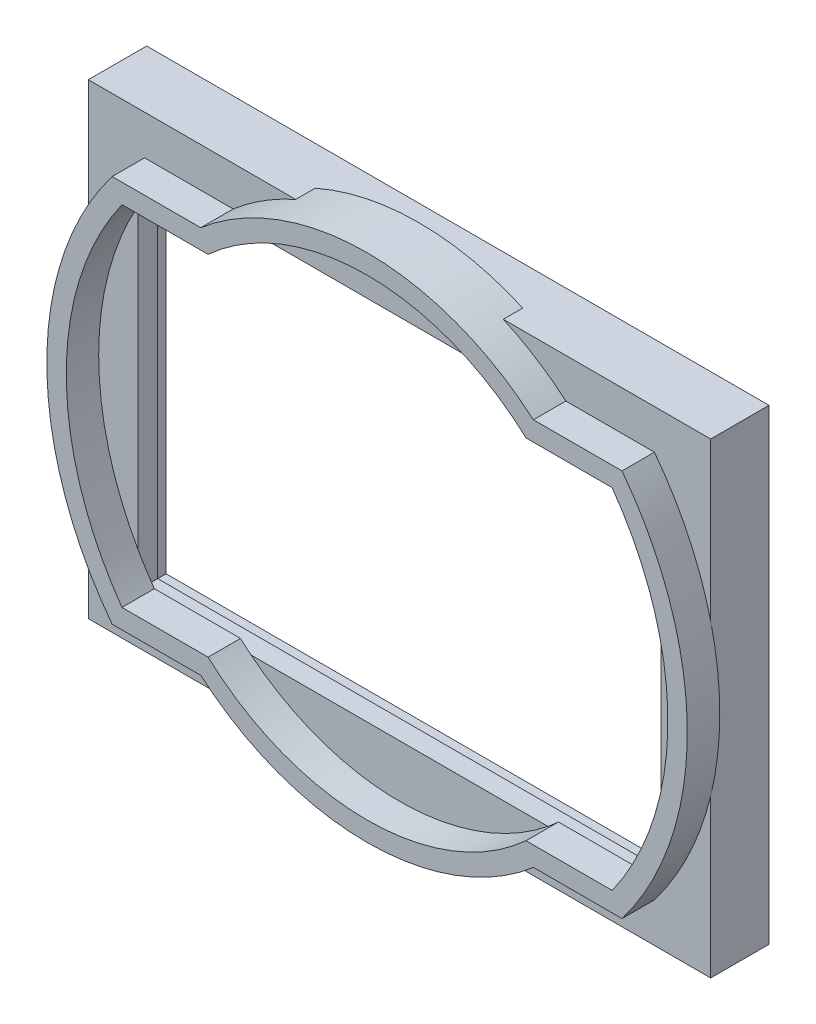
from build123d import *

# Parameters (mm, degrees)
EXTRUDE_1_DEPTH     = 2.5
EXTRUDE_START       = 1.5
SKETCH_3_W          = 40.3
SKETCH_3_H          = 28.3
EXTRUDE_2_DEPTH     = 1.5
SKETCH_4_W          = 48
SKETCH_4_H          = 36
SKETCH_4_W_2        = 45
SKETCH_4_H_2        = 33
EXTRUDE_3_DEPTH     = 3
EXTRUDE_4_DEPTH     = 1.5
CUT_EXTRUDE_1_DEPTH = 1.5


with BuildPart() as part:
    # 草图1 → 凸台-拉伸1 (new body)
    with BuildSketch(Plane.XY):
        with BuildLine():
            Line((-19.661828501, 14.95), (-12.82916599, 14.95))
            ThreePointArc((-12.82916599, 14.95), (0, 19.7), (12.82916599, 14.95))
            Line((12.82916599, 14.95), (19.661828501, 14.95))
            ThreePointArc((19.661828501, 14.95), (24.7, 0), (19.661828501, -14.95))
            Line((19.661828501, -14.95), (12.82916599, -14.95))
            ThreePointArc((12.82916599, -14.95), (0, -19.7), (-12.82916599, -14.95))
            Line((-12.82916599, -14.95), (-19.661828501, -14.95))
            ThreePointArc((-19.661828501, -14.95), (-24.7, 0), (-19.661828501, 14.95))
        make_face()
        with BuildLine():
            Line((-18.903372715, 13.45), (-12.261219352, 13.45))
            ThreePointArc((-12.261219352, 13.45), (0, 18.2), (12.261219352, 13.45))
            Line((12.261219352, 13.45), (18.903372715, 13.45))
            ThreePointArc((18.903372715, 13.45), (23.2, 0), (18.903372715, -13.45))
            Line((18.903372715, -13.45), (12.261219352, -13.45))
            ThreePointArc((12.261219352, -13.45), (0, -18.2), (-12.261219352, -13.45))
            Line((-12.261219352, -13.45), (-18.903372715, -13.45))
            ThreePointArc((-18.903372715, -13.45), (-23.2, 0), (-18.903372715, 13.45))
        make_face(mode=Mode.SUBTRACT)
    extrude(amount=EXTRUDE_1_DEPTH)

    # 草图3 → 凸台-拉伸2 (add)
    with BuildSketch(Plane(origin=(0, 0, 0), x_dir=(-1, 0, 0), z_dir=(0, 0, -1)).offset(EXTRUDE_START)):
        with BuildLine():
            Line((-21.5, -12.158947323), (-21.5, -15.5))
            Line((-21.5, -15.5), (-12.158947323, -15.5))
            ThreePointArc((-12.158947323, -15.5), (0, -19.7), (12.158947323, -15.5))
            Line((12.158947323, -15.5), (21.5, -15.5))
            Line((21.5, -15.5), (21.5, -12.158947323))
            ThreePointArc((21.5, -12.158947323), (24.7, 0), (21.5, 12.158947323))
            Line((21.5, 12.158947323), (21.5, 15.5))
            Line((21.5, 15.5), (12.158947323, 15.5))
            ThreePointArc((12.158947323, 15.5), (0, 19.7), (-12.158947323, 15.5))
            Line((-12.158947323, 15.5), (-21.5, 15.5))
            Line((-21.5, 15.5), (-21.5, 12.158947323))
            ThreePointArc((-21.5, 12.158947323), (-24.7, 0), (-21.5, -12.158947323))
        make_face()
        Rectangle(SKETCH_3_W, SKETCH_3_H, mode=Mode.SUBTRACT)
    extrude(amount=-EXTRUDE_2_DEPTH)

    # 草图4 → 凸台-拉伸3 (add)
    with BuildSketch(Plane(origin=(0, 0, -1.5), x_dir=(-1, 0, 0), z_dir=(0, 0, -1))):
        Rectangle(SKETCH_4_W, SKETCH_4_H)
        Rectangle(SKETCH_4_W_2, SKETCH_4_H_2, mode=Mode.SUBTRACT)
    extrude(amount=EXTRUDE_3_DEPTH)

    # 草图4<2> → 凸台-拉伸4 (add)
    with BuildSketch(Plane(origin=(0, 0, -1.5), x_dir=(-1, 0, 0), z_dir=(0, 0, -1))):
        with BuildLine():
            ThreePointArc((-21.5, -12.158947323), (-22.968434744, -9.085208055), (-24, -5.838664231))
            Line((-24, -5.838664231), (-24, -18))
            Line((-24, -18), (-8.005623024, -18))
            ThreePointArc((-8.005623024, -18), (-10.159477069, -16.87824119), (-12.158947323, -15.5))
            Line((-12.158947323, -15.5), (-21.5, -15.5))
            Line((-21.5, -15.5), (-21.5, -12.158947323))
        make_face()
        with BuildLine():
            ThreePointArc((12.158947323, -15.5), (10.159477069, -16.87824119), (8.005623024, -18))
            Line((8.005623024, -18), (24, -18))
            Line((24, -18), (24, -5.838664231))
            ThreePointArc((24, -5.838664231), (22.968434744, -9.085208055), (21.5, -12.158947323))
            Line((21.5, -12.158947323), (21.5, -15.5))
            Line((21.5, -15.5), (12.158947323, -15.5))
        make_face()
        with BuildLine():
            ThreePointArc((-24, 5.838664231), (-22.968434744, 9.085208055), (-21.5, 12.158947323))
            Line((-21.5, 12.158947323), (-21.5, 15.5))
            Line((-21.5, 15.5), (-12.158947323, 15.5))
            ThreePointArc((-12.158947323, 15.5), (-10.159477069, 16.87824119), (-8.005623024, 18))
            Line((-8.005623024, 18), (-24, 18))
            Line((-24, 18), (-24, 5.838664231))
        make_face()
        with BuildLine():
            ThreePointArc((21.5, 12.158947323), (22.968434744, 9.085208055), (24, 5.838664231))
            Line((24, 5.838664231), (24, 18))
            Line((24, 18), (8.005623024, 18))
            ThreePointArc((8.005623024, 18), (10.159477069, 16.87824119), (12.158947323, 15.5))
            Line((12.158947323, 15.5), (21.5, 15.5))
            Line((21.5, 15.5), (21.5, 12.158947323))
        make_face()
    extrude(amount=-EXTRUDE_4_DEPTH)

    # 草图4<3> → 切除-拉伸1 (cut)
    with BuildSketch(Plane(origin=(0, 0, -1.5), x_dir=(-1, 0, 0), z_dir=(0, 0, -1))):
        with BuildLine():
            ThreePointArc((-24, 5.838664231), (-24.7, 0), (-24, -5.838664231))
            Line((-24, -5.838664231), (-24, 5.838664231))
        make_face()
        with BuildLine():
            Line((24, 5.838664231), (24, -5.838664231))
            ThreePointArc((24, -5.838664231), (24.7, 0), (24, 5.838664231))
        make_face()
    extrude(amount=-CUT_EXTRUDE_1_DEPTH, mode=Mode.SUBTRACT)


solid = part.part
